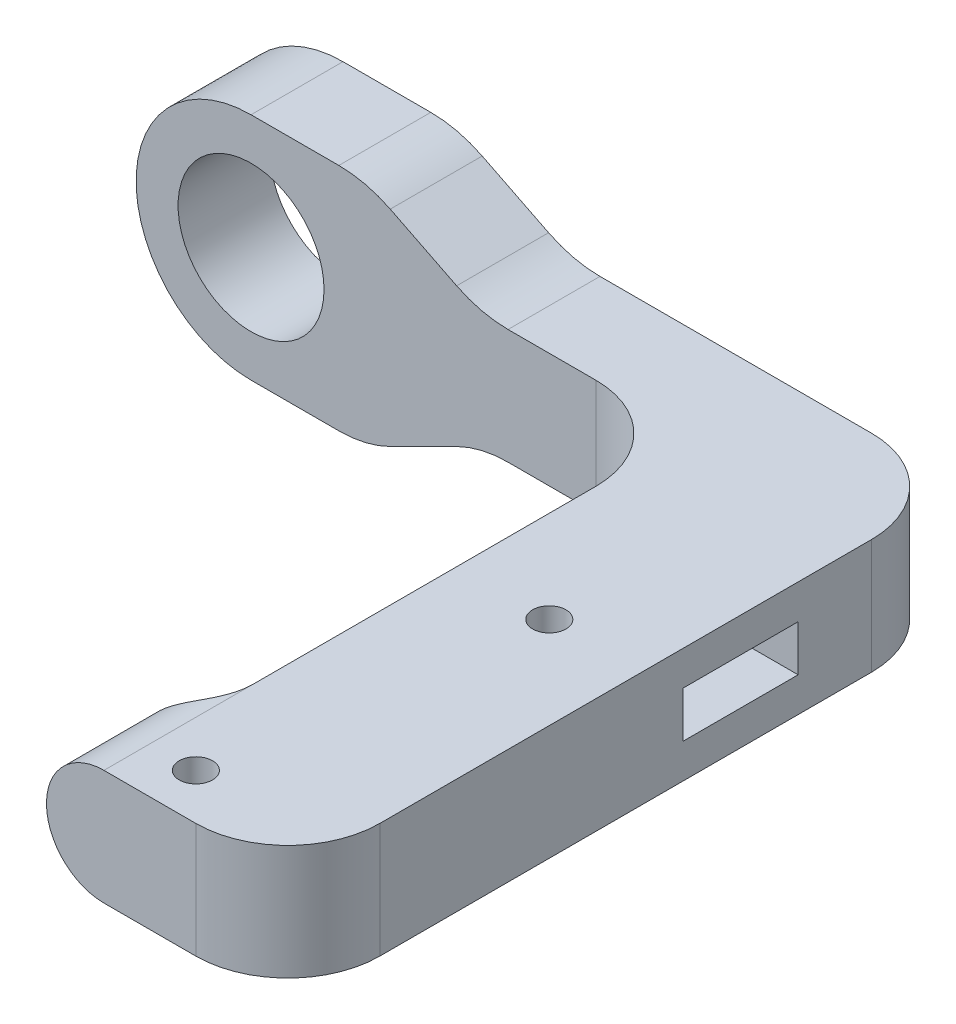
from build123d import *

# Parameters (mm, degrees)
SKETCH1_W           = 16
SKETCH1_H           = 10
BOSS_EXTRUDE1_DEPTH = 58.8
BOSS_EXTRUDE2_DEPTH = 8
SKETCH4_R           = 6.35
BOSS_EXTRUDE4_DEPTH = 8
SKETCH7_R           = 1.45
CUT_EXTRUDE1_DEPTH  = 83.573845738
SKETCH13_R          = 1.45
CUT_EXTRUDE5_DEPTH  = 83.573845738
SKETCH14_W          = 10
SKETCH14_H          = 4
CUT_EXTRUDE6_DEPTH  = 77.560041797
FILLET1_R           = 8
FILLET4_R           = 10
FILLET5_R           = 5
FILLET6_R           = 8


with BuildPart() as part:
    # Sketch1 → Boss-Extrude1 (new body)
    with BuildSketch(Plane.XY):
        Rectangle(SKETCH1_W, SKETCH1_H)
    extrude(amount=BOSS_EXTRUDE1_DEPTH)

    # Sketch2 → Boss-Extrude2 (add)
    with BuildSketch(Plane.XY.offset(58.8)):
        with BuildLine():
            Line((-8, 5), (-8, -5))
            ThreePointArc((-8, -5), (-13, 0), (-8, 5))
        make_face()
    extrude(amount=-BOSS_EXTRUDE2_DEPTH)

    # Sketch4 → Boss-Extrude4 (add)
    with BuildSketch(Plane.XY):
        with BuildLine():
            Line((-8, 5), (-8, -5))
            Line((-8, -5), (-26, -5))
            Line((-26, -5), (-36, -10))
            Line((-36, -10), (-46, -10))
            ThreePointArc((-46, -10), (-56, 0), (-46, 10))
            Line((-46, 10), (-36, 10))
            Line((-36, 10), (-26, 5))
            Line((-26, 5), (-8, 5))
        make_face()
        with Locations((-46, 0)):
            Circle(SKETCH4_R, mode=Mode.SUBTRACT)
    extrude(amount=BOSS_EXTRUDE4_DEPTH)

    # Sketch7 → Cut-Extrude1 (cut, through all)
    with BuildSketch(Plane.XZ.offset(5)):
        with Locations((-4, 54.8)):
            Circle(SKETCH7_R)
    extrude(amount=-CUT_EXTRUDE1_DEPTH, mode=Mode.SUBTRACT)

    # Sketch13 → Cut-Extrude5 (cut, through all)
    with BuildSketch(Plane(origin=(0, 5, 0), x_dir=(1, 0, 0), z_dir=(0, 1, 0))):
        with Locations(Location((0, -28.05, 0), (0, 0, 180))):
            Circle(SKETCH13_R)
    extrude(amount=-CUT_EXTRUDE5_DEPTH, mode=Mode.SUBTRACT)

    # Sketch14 → Cut-Extrude6 (cut, through all)
    with BuildSketch(Plane.ZY.offset(8)):
        with Locations((19.4, 0)):
            Rectangle(SKETCH14_W, SKETCH14_H)
    extrude(amount=-CUT_EXTRUDE6_DEPTH, mode=Mode.SUBTRACT)

    # Fillet1
    fillet1_edges = [part.edges().sort_by_distance(p)[0] for p in [
        (8, 0, 58.8),
        (8, 0, 0),
    ]]
    fillet(fillet1_edges, radius=FILLET1_R)

    # Fillet4
    fillet4_edges = [part.edges().sort_by_distance(p)[0] for p in [
        (-26, 5, 4),
        (-36, 10, 4),
        (-36, -10, 4),
        (-26, -5, 4),
    ]]
    fillet(fillet4_edges, radius=FILLET4_R)

    # Fillet5
    # the kernel refuses this fillet: 5 mm, written as the material it adds along each edge
    with BuildSketch(Plane(origin=(-8, 17.5, 50.8), x_dir=(0, 0, -1), z_dir=(0, -1, 0))) as fillet5_piece_1_section:
        with BuildLine():
            CenterArc((FILLET5_R, -FILLET5_R), FILLET5_R, 90, 90)
            Line((0, -FILLET5_R), (0, 0))
            Line((0, 0), (FILLET5_R, 0))
        make_face()
    fillet5_piece_1 = extrude(amount=35, mode=Mode.PRIVATE)
    fillet5_piece_1 = fillet5_piece_1 & Plane(origin=(-8, 0, 49.649047906), x_dir=(0, -1, 0), z_dir=(0, 0, 1)) * Cylinder(5, 90, mode=Mode.PRIVATE)
    add(fillet5_piece_1)

    # Fillet6
    # the kernel refuses this fillet: 8 mm, written as the material it adds along each edge
    with BuildSketch(Plane(origin=(-8, 5, 8), x_dir=(-1, 0, 0), z_dir=(0, -1, 0))) as fillet6_piece_1_section:
        with BuildLine():
            CenterArc((FILLET6_R, -FILLET6_R), FILLET6_R, 90, 90)
            Line((0, -FILLET6_R), (0, 0))
            Line((0, 0), (FILLET6_R, 0))
        make_face()
    fillet6_piece_1 = extrude(amount=10, mode=Mode.PRIVATE)
    fillet6_piece_1 = split(fillet6_piece_1, bisect_by=Plane(origin=(-9.850932113, 2, 9.698021043), z_dir=(0, 1, 0)), keep=Keep.TOP, mode=Mode.PRIVATE)
    fillet6_piece_1 = split(fillet6_piece_1, bisect_by=Plane(origin=(-9.850932113, 3.5, 14.4), z_dir=(0, 0, -1)), keep=Keep.TOP, mode=Mode.PRIVATE)
    add(fillet6_piece_1)
    with BuildSketch(Plane(origin=(-8, 5, 8), x_dir=(-1, 0, 0), z_dir=(0, -1, 0))) as fillet6_piece_2_section:
        with BuildLine():
            CenterArc((FILLET6_R, -FILLET6_R), FILLET6_R, 90, 90)
            Line((0, -FILLET6_R), (0, 0))
            Line((0, 0), (FILLET6_R, 0))
        make_face()
    fillet6_piece_2 = extrude(amount=10, mode=Mode.PRIVATE)
    fillet6_piece_2 = split(fillet6_piece_2, bisect_by=Plane(origin=(-7.952247513, 2, 15.099340059), z_dir=(0, 1, 0)), keep=Keep.TOP, mode=Mode.PRIVATE)
    fillet6_piece_2 = split(fillet6_piece_2, bisect_by=Plane(origin=(-7.952247513, 3.5, 14.4), z_dir=(0, 0, 1)), keep=Keep.TOP, mode=Mode.PRIVATE)
    add(fillet6_piece_2)
    with BuildSketch(Plane(origin=(-8, 5, 8), x_dir=(-1, 0, 0), z_dir=(0, -1, 0))) as fillet6_piece_3_section:
        with BuildLine():
            CenterArc((FILLET6_R, -FILLET6_R), FILLET6_R, 90, 90)
            Line((0, -FILLET6_R), (0, 0))
            Line((0, 0), (FILLET6_R, 0))
        make_face()
    fillet6_piece_3 = extrude(amount=10, mode=Mode.PRIVATE)
    fillet6_piece_3 = split(fillet6_piece_3, bisect_by=Plane(origin=(-9.850932113, 2, 9.698021043), z_dir=(0, -1, 0)), keep=Keep.TOP, mode=Mode.PRIVATE)
    fillet6_piece_3 = split(fillet6_piece_3, bisect_by=Plane(origin=(-9.850932113, -2, 9.698021043), z_dir=(0, 1, 0)), keep=Keep.TOP, mode=Mode.PRIVATE)
    fillet6_piece_3 = split(fillet6_piece_3, bisect_by=Plane(origin=(-9.850932113, 0, 14.4), z_dir=(0, 0, -1)), keep=Keep.TOP, mode=Mode.PRIVATE)
    add(fillet6_piece_3)
    with BuildSketch(Plane(origin=(-8, 5, 8), x_dir=(-1, 0, 0), z_dir=(0, -1, 0))) as fillet6_piece_4_section:
        with BuildLine():
            CenterArc((FILLET6_R, -FILLET6_R), FILLET6_R, 90, 90)
            Line((0, -FILLET6_R), (0, 0))
            Line((0, 0), (FILLET6_R, 0))
        make_face()
    fillet6_piece_4 = extrude(amount=10, mode=Mode.PRIVATE)
    fillet6_piece_4 = split(fillet6_piece_4, bisect_by=Plane(origin=(-9.850932113, -2, 9.698021043), z_dir=(0, -1, 0)), keep=Keep.TOP, mode=Mode.PRIVATE)
    fillet6_piece_4 = split(fillet6_piece_4, bisect_by=Plane(origin=(-9.850932113, -3.5, 14.4), z_dir=(0, 0, -1)), keep=Keep.TOP, mode=Mode.PRIVATE)
    add(fillet6_piece_4)
    with BuildSketch(Plane(origin=(-8, 5, 8), x_dir=(-1, 0, 0), z_dir=(0, -1, 0))) as fillet6_piece_5_section:
        with BuildLine():
            CenterArc((FILLET6_R, -FILLET6_R), FILLET6_R, 90, 90)
            Line((0, -FILLET6_R), (0, 0))
            Line((0, 0), (FILLET6_R, 0))
        make_face()
    fillet6_piece_5 = extrude(amount=10, mode=Mode.PRIVATE)
    fillet6_piece_5 = split(fillet6_piece_5, bisect_by=Plane(origin=(-7.952247513, -2, 15.099340059), z_dir=(0, -1, 0)), keep=Keep.TOP, mode=Mode.PRIVATE)
    fillet6_piece_5 = split(fillet6_piece_5, bisect_by=Plane(origin=(-7.952247513, -3.5, 14.4), z_dir=(0, 0, 1)), keep=Keep.TOP, mode=Mode.PRIVATE)
    add(fillet6_piece_5)


solid = part.part
